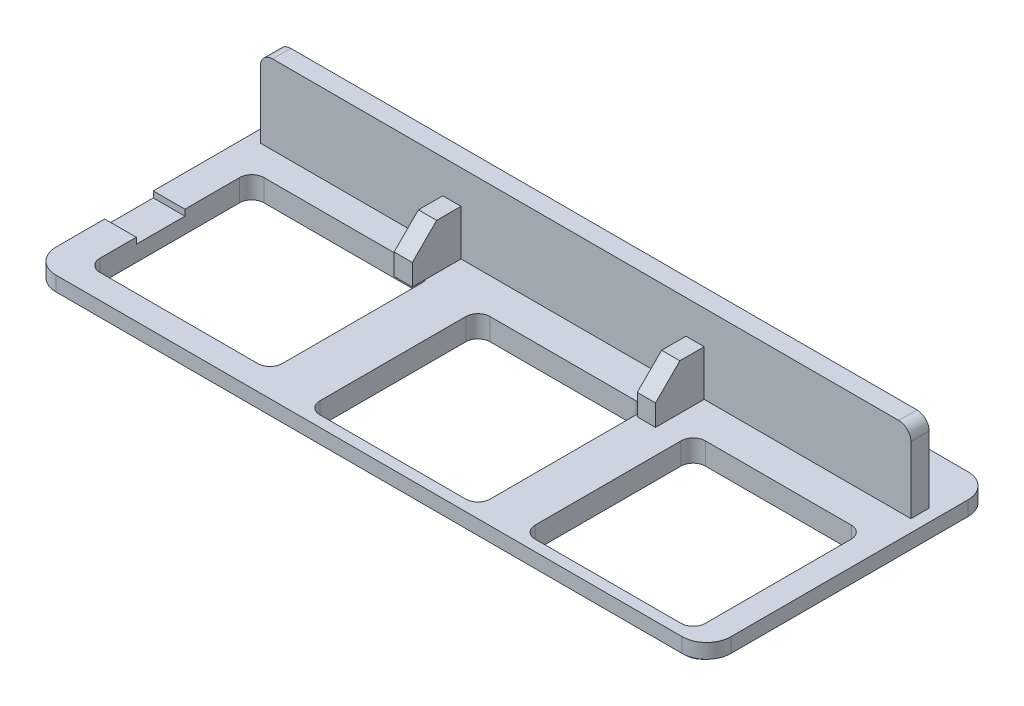
from build123d import *

# Parameters (mm, degrees)
SKETCH_1_W          = 55.5
SKETCH_1_H          = 23.5
EXTRUDE_1_DEPTH     = 1.2
FILLET_1_R          = 2
SKETCH_2_W          = 53.7
SKETCH_2_H          = 22.3
EXTRUDE_2_DEPTH     = 0.6
SKETCH_3_W          = 15
SKETCH_3_H          = 13.5
SKETCH_3_W_2        = 14
SKETCH_3_H_2        = 14
CUT_EXTRUDE_1_DEPTH = 3
FILLET_2_R          = 1
SKETCH_4_W          = 15.5
SKETCH_4_H          = 3.997435945
CUT_EXTRUDE_2_DEPTH = 0.5
SKETCH_5_W          = 53.5
SKETCH_5_H          = 1.5
EXTRUDE_3_DEPTH     = 6.5
FILLET_3_R          = 1
SKETCH_6_W          = 1.5
SKETCH_6_H          = 4
EXTRUDE_4_DEPTH     = 3.75
CHAMFER_1_SIZE      = 2
FILLET_4_R          = 1.5


with BuildPart() as part:
    # 草图1 → 凸台-拉伸1 (new body)
    with BuildSketch(Plane(origin=(0, 0, 0), x_dir=(1, 0, 0), z_dir=(0, 1, 0))):
        Rectangle(SKETCH_1_W, SKETCH_1_H)
    extrude(amount=EXTRUDE_1_DEPTH)

    # 圆角1
    fillet_1_edges = [part.edges().sort_by_distance(p)[0] for p in [
        (-27.75, 0.6, 11.75),
        (27.75, 0.6, 11.75),
        (-27.75, 0.6, -11.75),
        (27.75, 0.6, -11.75),
    ]]
    fillet(fillet_1_edges, radius=FILLET_1_R)

    # 草图2 → 凸台-拉伸2 (add)
    with BuildSketch(Plane.XZ):
        Rectangle(SKETCH_2_W, SKETCH_2_H)
    extrude(amount=EXTRUDE_2_DEPTH)

    # 草图3 → 切除-拉伸1 (cut)
    with BuildSketch(Plane.XZ.offset(0.6)):
        with Locations((-17.65, 3)):
            Rectangle(SKETCH_3_W, SKETCH_3_H)
        with Locations((1.05, 3.85)):
            Rectangle(SKETCH_3_W_2, SKETCH_3_H_2)
        with Locations((18.75, 3.85)):
            Rectangle(SKETCH_3_W_2, SKETCH_3_H_2)
    extrude(amount=-CUT_EXTRUDE_1_DEPTH, mode=Mode.SUBTRACT)

    # 圆角2
    fillet_2_edges = [part.edges().sort_by_distance(p)[0] for p in [
        (-25.15, 0.3, 9.75),
        (-10.15, 0.3, 9.75),
        (-5.95, 0.3, 10.85),
        (8.05, 0.3, 10.85),
        (25.75, 0.3, 10.85),
        (11.75, 0.3, 10.85),
        (25.75, 0.3, -3.15),
        (11.75, 0.3, -3.15),
        (8.05, 0.3, -3.15),
        (-5.95, 0.3, -3.15),
        (-10.15, 0.3, -3.75),
        (-25.15, 0.3, -3.75),
    ]]
    fillet(fillet_2_edges, radius=FILLET_2_R)

    # 草图4 → 切除-拉伸2 (cut)
    with BuildSketch(Plane(origin=(0, 1.2, 0), x_dir=(1, 0, 0), z_dir=(0, 1, 0))):
        with Locations((-20, -3.751282028)):
            Rectangle(SKETCH_4_W, SKETCH_4_H)
    extrude(amount=-CUT_EXTRUDE_2_DEPTH, mode=Mode.SUBTRACT)

    # 草图5 → 凸台-拉伸3 (add)
    with BuildSketch(Plane(origin=(0, 1.2, 0), x_dir=(1, 0, 0), z_dir=(0, 1, 0))):
        with Locations((0, 6.804632487)):
            Rectangle(SKETCH_5_W, SKETCH_5_H)
    extrude(amount=EXTRUDE_3_DEPTH)

    # 圆角3
    fillet_3_edges = [part.edges().sort_by_distance(p)[0] for p in [
        (-26.75, 7.7, -6.804632487),
        (26.75, 7.7, -6.804632487),
    ]]
    fillet(fillet_3_edges, radius=FILLET_3_R)

    # 草图6 → 凸台-拉伸4 (add)
    with BuildSketch(Plane(origin=(0, 1.2, 0), x_dir=(1, 0, 0), z_dir=(0, 1, 0))):
        with Locations((9, 4.054632487)):
            Rectangle(SKETCH_6_W, SKETCH_6_H)
        with Locations((-11, 4.054632487)):
            Rectangle(SKETCH_6_W, SKETCH_6_H)
    extrude(amount=EXTRUDE_4_DEPTH)

    # 倒角1
    chamfer_1_edges = [part.edges().sort_by_distance(p)[0] for p in [
        (-11, 4.95, -2.054632487),
        (9, 4.95, -2.054632487),
    ]]
    chamfer(chamfer_1_edges, length=CHAMFER_1_SIZE)

    # 圆角4
    fillet_4_edges = [part.edges().sort_by_distance(p)[0] for p in [
        (-26.85, -0.3, -11.15),
        (26.85, -0.3, -11.15),
        (26.85, -0.3, 11.15),
        (-26.85, -0.3, 11.15),
    ]]
    fillet(fillet_4_edges, radius=FILLET_4_R)


solid = part.part
